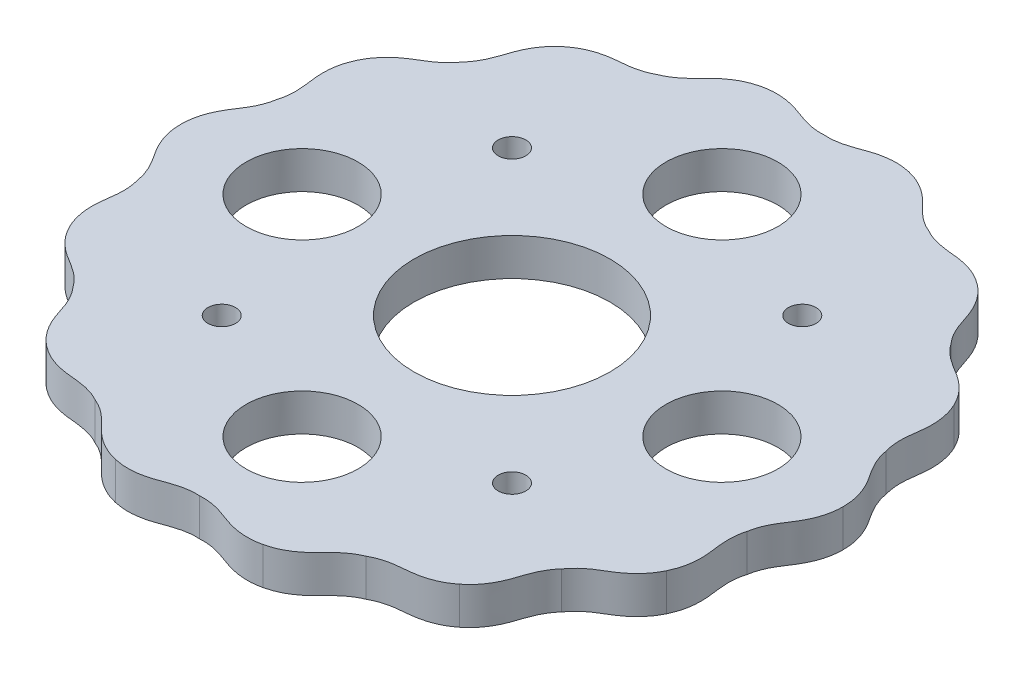
from build123d import *

# Parameters (mm, degrees)
BOSS_EXTRUDE3_DEPTH = 4
SKETCH2_R           = 10.5
SKETCH2_R_2         = 6
CUT_EXTRUDE1_DEPTH  = 5
SKETCH2_4_R         = 1.48
CUT_EXTRUDE2_DEPTH  = 2.22


with BuildPart() as part:
    # Sketch1 → Boss-Extrude3 (new body)
    with BuildSketch(Plane(origin=(0, 0, 0), x_dir=(1, 0, 0), z_dir=(0, 1, 0))):
        with BuildLine():
            Line((35.500002326, 0.003735881), (35.500002326, 0))
            Line((35.500002326, 0), (35.500002326, -0.003735881))
            add(Edge.make_bspline(
                [(32.644810899, -7.45096506), (32.674793712, -7.260710929), (32.757965618, -6.873262555), (32.975088878, -6.197475635), (33.30681421, -5.487322542), (33.693887271, -4.83935734), (34.139372051, -4.165162167), (34.499748971, -3.6014921), (34.870711868, -2.889611748), (35.149566879, -2.192738575), (35.418263863, -1.23361479), (35.50061524, -0.495919336), (35.500002326, -0.003735881)],
                knots=[0.02301065, 0.02301065, 0.02301065, 0.02301065, 0.053541567, 0.084072485, 0.145134319, 0.206196153, 0.267257988, 0.389381656, 0.511505325, 0.633628994, 0.755752663, 1, 1, 1, 1], degree=3))
            add(Edge.make_bspline(
                [(31.986017844, -15.399507835), (32.200120458, -14.956331799), (32.445998494, -14.255960238), (32.62005909, -13.275236314), (32.671181344, -12.526384626), (32.645828632, -11.724047822), (32.565707523, -11.059836954), (32.456861927, -10.25911949), (32.389262714, -9.507378309), (32.398512397, -8.723622254), (32.496104055, -8.020553026), (32.589276306, -7.635387164), (32.644810899, -7.45096506)],
                knots=[0.02301065, 0.02301065, 0.02301065, 0.02301065, 0.267257988, 0.389381656, 0.511505325, 0.633628994, 0.755752663, 0.816814497, 0.877876331, 0.938938166, 0.969469083, 1, 1, 1, 1], degree=3))
            Line((31.986017844, -15.399507835), (31.984396906, -15.402873748))
            Line((31.984396906, -15.402873748), (31.982775968, -15.406239661))
            add(Edge.make_bspline(
                [(26.179105738, -20.877140171), (26.288667493, -20.718736177), (26.531710341, -20.405744191), (27.020544594, -19.891087467), (27.62754267, -19.395191866), (28.257425012, -18.979340099), (28.951315253, -18.565199839), (29.520570914, -18.213712342), (30.163670245, -17.733285076), (30.717271866, -17.226414698), (31.375507699, -16.478857279), (31.769777787, -15.849947564), (31.982775968, -15.406239661)],
                knots=[0.02301065, 0.02301065, 0.02301065, 0.02301065, 0.053541567, 0.084072485, 0.145134319, 0.206196153, 0.267257988, 0.389381656, 0.511505325, 0.633628994, 0.755752663, 1, 1, 1, 1], degree=3))
            add(Edge.make_bspline(
                [(22.136810246, -27.752690162), (22.521996911, -27.446297993), (23.047405198, -26.921967502), (23.62974854, -26.113887841), (24.00072267, -25.461376898), (24.326001557, -24.727496287), (24.542005228, -24.094299727), (24.791357022, -23.325651886), (25.05662051, -22.619026286), (25.405013194, -21.916899767), (25.797990545, -21.325799714), (26.049053047, -21.019203188), (26.179105738, -20.877140171)],
                knots=[0.02301065, 0.02301065, 0.02301065, 0.02301065, 0.267257988, 0.389381656, 0.511505325, 0.633628994, 0.755752663, 0.816814497, 0.877876331, 0.938938166, 0.969469083, 1, 1, 1, 1], degree=3))
            Line((22.136810246, -27.752690162), (22.133889416, -27.755019446))
            Line((22.133889416, -27.755019446), (22.130968587, -27.75734873))
            add(Edge.make_bspline(
                [(14.52830762, -30.168341629), (14.695748267, -30.073161626), (15.05052444, -29.89661793), (15.714250068, -29.645025478), (16.476297475, -29.461605575), (17.224233175, -29.360231784), (18.029095404, -29.288171996), (18.694481743, -29.218483478), (19.482343797, -29.064663811), (20.201044438, -28.848188121), (21.118447439, -28.460259983), (21.746546212, -28.06469929), (22.130968587, -27.75734873)],
                knots=[0.02301065, 0.02301065, 0.02301065, 0.02301065, 0.053541567, 0.084072485, 0.145134319, 0.206196153, 0.267257988, 0.389381656, 0.511505325, 0.633628994, 0.755752663, 1, 1, 1, 1], degree=3))
            add(Edge.make_bspline(
                [(7.903135888, -34.609111839), (8.383115662, -34.500188263), (9.083990645, -34.255748926), (9.959276491, -33.780363616), (10.576626521, -33.353431213), (11.188111536, -32.833360849), (11.657457809, -32.356590942), (12.215619812, -31.772252855), (12.761207314, -31.250698702), (13.379739556, -30.769266488), (13.990268616, -30.407210225), (14.349495361, -30.239908237), (14.52830762, -30.168341629)],
                knots=[0.02301065, 0.02301065, 0.02301065, 0.02301065, 0.267257988, 0.389381656, 0.511505325, 0.633628994, 0.755752663, 0.816814497, 0.877876331, 0.938938166, 0.969469083, 1, 1, 1, 1], degree=3))
            Line((7.903135888, -34.609111839), (7.899493673, -34.60994315))
            Line((7.899493673, -34.60994315), (7.895851458, -34.610774462))
            add(Edge.make_bspline(
                [(0, -33.484333037), (0.192155866, -33.471228592), (0.588397592, -33.466099831), (1.295555593, -33.527402621), (2.061719496, -33.692786976), (2.779570716, -33.925969485), (3.535992098, -34.210262493), (4.165721189, -34.43617562), (4.942300224, -34.639429423), (5.683752409, -34.756224087), (6.678619663, -34.804759157), (7.416144457, -34.72089313), (7.895851458, -34.610774462)],
                knots=[0.02301065, 0.02301065, 0.02301065, 0.02301065, 0.053541567, 0.084072485, 0.145134319, 0.206196153, 0.267257988, 0.389381656, 0.511505325, 0.633628994, 0.755752663, 1, 1, 1, 1], degree=3))
            add(Edge.make_bspline(
                [(-7.895851458, -34.610774462), (-7.416144457, -34.72089313), (-6.678619663, -34.804759157), (-5.683752409, -34.756224087), (-4.942300224, -34.639429423), (-4.165721189, -34.43617562), (-3.535992098, -34.210262493), (-2.779570716, -33.925969485), (-2.061719496, -33.692786976), (-1.295555593, -33.527402621), (-0.588397592, -33.466099831), (-0.192155866, -33.471228592), (0, -33.484333037)],
                knots=[0.02301065, 0.02301065, 0.02301065, 0.02301065, 0.267257988, 0.389381656, 0.511505325, 0.633628994, 0.755752663, 0.816814497, 0.877876331, 0.938938166, 0.969469083, 1, 1, 1, 1], degree=3))
            Line((-7.895851458, -34.610774462), (-7.899493673, -34.60994315))
            Line((-7.899493673, -34.60994315), (-7.903135888, -34.609111839))
            add(Edge.make_bspline(
                [(-14.52830762, -30.168341629), (-14.349495361, -30.239908237), (-13.990268616, -30.407210225), (-13.379739556, -30.769266488), (-12.761207314, -31.250698702), (-12.215619812, -31.772252855), (-11.657457809, -32.356590942), (-11.188111536, -32.833360849), (-10.576626521, -33.353431213), (-9.959276491, -33.780363616), (-9.083990645, -34.255748926), (-8.383115662, -34.500188263), (-7.903135888, -34.609111839)],
                knots=[0.02301065, 0.02301065, 0.02301065, 0.02301065, 0.053541567, 0.084072485, 0.145134319, 0.206196153, 0.267257988, 0.389381656, 0.511505325, 0.633628994, 0.755752663, 1, 1, 1, 1], degree=3))
            add(Edge.make_bspline(
                [(-22.130968587, -27.75734873), (-21.746546212, -28.06469929), (-21.118447439, -28.460259983), (-20.201044438, -28.848188121), (-19.482343797, -29.064663811), (-18.694481743, -29.218483478), (-18.029095404, -29.288171996), (-17.224233175, -29.360231784), (-16.476297475, -29.461605575), (-15.714250068, -29.645025478), (-15.05052444, -29.89661793), (-14.695748267, -30.073161626), (-14.52830762, -30.168341629)],
                knots=[0.02301065, 0.02301065, 0.02301065, 0.02301065, 0.267257988, 0.389381656, 0.511505325, 0.633628994, 0.755752663, 0.816814497, 0.877876331, 0.938938166, 0.969469083, 1, 1, 1, 1], degree=3))
            Line((-22.130968587, -27.75734873), (-22.133889416, -27.755019446))
            Line((-22.133889416, -27.755019446), (-22.136810246, -27.752690162))
            add(Edge.make_bspline(
                [(-26.179105738, -20.877140171), (-26.049053047, -21.019203188), (-25.797990545, -21.325799714), (-25.405013194, -21.916899767), (-25.05662051, -22.619026286), (-24.791357022, -23.325651886), (-24.542005228, -24.094299727), (-24.326001557, -24.727496287), (-24.00072267, -25.461376898), (-23.62974854, -26.113887841), (-23.047405198, -26.921967502), (-22.521996911, -27.446297993), (-22.136810246, -27.752690162)],
                knots=[0.02301065, 0.02301065, 0.02301065, 0.02301065, 0.053541567, 0.084072485, 0.145134319, 0.206196153, 0.267257988, 0.389381656, 0.511505325, 0.633628994, 0.755752663, 1, 1, 1, 1], degree=3))
            add(Edge.make_bspline(
                [(-31.982775968, -15.406239661), (-31.769777787, -15.849947564), (-31.375507698, -16.478857279), (-30.717271866, -17.226414698), (-30.163670245, -17.733285076), (-29.520570914, -18.213712342), (-28.951315253, -18.565199839), (-28.257425012, -18.979340099), (-27.62754267, -19.395191866), (-27.020544594, -19.891087467), (-26.531710341, -20.405744191), (-26.288667493, -20.718736177), (-26.179105738, -20.877140171)],
                knots=[0.02301065, 0.02301065, 0.02301065, 0.02301065, 0.267257988, 0.389381656, 0.511505325, 0.633628994, 0.755752663, 0.816814497, 0.877876331, 0.938938166, 0.969469083, 1, 1, 1, 1], degree=3))
            Line((-31.982775968, -15.406239661), (-31.984396906, -15.402873748))
            Line((-31.984396906, -15.402873748), (-31.986017844, -15.399507835))
            add(Edge.make_bspline(
                [(-32.644810899, -7.45096506), (-32.589276306, -7.635387164), (-32.496104055, -8.020553026), (-32.398512397, -8.723622254), (-32.389262714, -9.507378309), (-32.456861927, -10.25911949), (-32.565707523, -11.059836954), (-32.645828632, -11.724047822), (-32.671181344, -12.526384626), (-32.62005909, -13.275236314), (-32.445998494, -14.255960238), (-32.200120458, -14.956331799), (-31.986017844, -15.399507835)],
                knots=[0.02301065, 0.02301065, 0.02301065, 0.02301065, 0.053541567, 0.084072485, 0.145134319, 0.206196153, 0.267257988, 0.389381656, 0.511505325, 0.633628994, 0.755752663, 1, 1, 1, 1], degree=3))
            add(Edge.make_bspline(
                [(-35.500002326, -0.003735881), (-35.50061524, -0.495919336), (-35.418263863, -1.23361479), (-35.149566879, -2.192738575), (-34.870711868, -2.889611748), (-34.499748971, -3.6014921), (-34.139372051, -4.165162167), (-33.693887271, -4.83935734), (-33.30681421, -5.487322542), (-32.975088878, -6.197475635), (-32.757965618, -6.873262555), (-32.674793712, -7.260710929), (-32.644810899, -7.45096506)],
                knots=[0.02301065, 0.02301065, 0.02301065, 0.02301065, 0.267257988, 0.389381656, 0.511505325, 0.633628994, 0.755752663, 0.816814497, 0.877876331, 0.938938166, 0.969469083, 1, 1, 1, 1], degree=3))
            Line((-35.500002326, -0.003735881), (-35.500002326, 0))
            Line((-35.500002326, 0), (-35.500002326, 0.003735881))
            add(Edge.make_bspline(
                [(-32.644810899, 7.45096506), (-32.674793712, 7.260710929), (-32.757965618, 6.873262555), (-32.975088878, 6.197475635), (-33.30681421, 5.487322542), (-33.693887271, 4.83935734), (-34.139372051, 4.165162167), (-34.499748971, 3.6014921), (-34.870711868, 2.889611748), (-35.149566879, 2.192738575), (-35.418263863, 1.23361479), (-35.50061524, 0.495919336), (-35.500002326, 0.003735881)],
                knots=[0.02301065, 0.02301065, 0.02301065, 0.02301065, 0.053541567, 0.084072485, 0.145134319, 0.206196153, 0.267257988, 0.389381656, 0.511505325, 0.633628994, 0.755752663, 1, 1, 1, 1], degree=3))
            add(Edge.make_bspline(
                [(-31.986017844, 15.399507835), (-32.200120458, 14.956331799), (-32.445998494, 14.255960238), (-32.62005909, 13.275236314), (-32.671181344, 12.526384626), (-32.645828632, 11.724047822), (-32.565707523, 11.059836954), (-32.456861927, 10.25911949), (-32.389262714, 9.507378309), (-32.398512397, 8.723622254), (-32.496104055, 8.020553026), (-32.589276306, 7.635387164), (-32.644810899, 7.45096506)],
                knots=[0.02301065, 0.02301065, 0.02301065, 0.02301065, 0.267257988, 0.389381656, 0.511505325, 0.633628994, 0.755752663, 0.816814497, 0.877876331, 0.938938166, 0.969469083, 1, 1, 1, 1], degree=3))
            Line((-31.986017844, 15.399507835), (-31.984396906, 15.402873748))
            Line((-31.984396906, 15.402873748), (-31.982775968, 15.406239661))
            add(Edge.make_bspline(
                [(-26.179105738, 20.877140171), (-26.288667493, 20.718736177), (-26.531710341, 20.405744191), (-27.020544594, 19.891087467), (-27.62754267, 19.395191866), (-28.257425012, 18.979340099), (-28.951315253, 18.565199839), (-29.520570914, 18.213712342), (-30.163670245, 17.733285076), (-30.717271866, 17.226414698), (-31.375507699, 16.478857278), (-31.769777787, 15.849947564), (-31.982775968, 15.406239661)],
                knots=[0.02301065, 0.02301065, 0.02301065, 0.02301065, 0.053541567, 0.084072485, 0.145134319, 0.206196153, 0.267257988, 0.389381656, 0.511505325, 0.633628994, 0.755752663, 1, 1, 1, 1], degree=3))
            add(Edge.make_bspline(
                [(-22.136810246, 27.752690162), (-22.521996911, 27.446297993), (-23.047405198, 26.921967502), (-23.62974854, 26.113887841), (-24.00072267, 25.461376898), (-24.326001557, 24.727496287), (-24.542005228, 24.094299727), (-24.791357022, 23.325651886), (-25.05662051, 22.619026286), (-25.405013194, 21.916899767), (-25.797990545, 21.325799714), (-26.049053047, 21.019203188), (-26.179105738, 20.877140171)],
                knots=[0.02301065, 0.02301065, 0.02301065, 0.02301065, 0.267257988, 0.389381656, 0.511505325, 0.633628994, 0.755752663, 0.816814497, 0.877876331, 0.938938166, 0.969469083, 1, 1, 1, 1], degree=3))
            Line((-22.136810246, 27.752690162), (-22.133889416, 27.755019446))
            Line((-22.133889416, 27.755019446), (-22.130968587, 27.75734873))
            add(Edge.make_bspline(
                [(-14.52830762, 30.168341629), (-14.695748267, 30.073161626), (-15.05052444, 29.89661793), (-15.714250068, 29.645025478), (-16.476297475, 29.461605575), (-17.224233175, 29.360231784), (-18.029095404, 29.288171996), (-18.694481743, 29.218483478), (-19.482343797, 29.064663811), (-20.201044438, 28.848188121), (-21.118447439, 28.460259983), (-21.746546212, 28.06469929), (-22.130968587, 27.75734873)],
                knots=[0.02301065, 0.02301065, 0.02301065, 0.02301065, 0.053541567, 0.084072485, 0.145134319, 0.206196153, 0.267257988, 0.389381656, 0.511505325, 0.633628994, 0.755752663, 1, 1, 1, 1], degree=3))
            add(Edge.make_bspline(
                [(-7.903135888, 34.609111839), (-8.383115662, 34.500188263), (-9.083990645, 34.255748926), (-9.959276491, 33.780363616), (-10.576626521, 33.353431213), (-11.188111536, 32.833360849), (-11.657457809, 32.356590942), (-12.215619812, 31.772252855), (-12.761207314, 31.250698702), (-13.379739556, 30.769266488), (-13.990268616, 30.407210225), (-14.349495361, 30.239908237), (-14.52830762, 30.168341629)],
                knots=[0.02301065, 0.02301065, 0.02301065, 0.02301065, 0.267257988, 0.389381656, 0.511505325, 0.633628994, 0.755752663, 0.816814497, 0.877876331, 0.938938166, 0.969469083, 1, 1, 1, 1], degree=3))
            Line((-7.903135888, 34.609111839), (-7.899493673, 34.60994315))
            Line((-7.899493673, 34.60994315), (-7.895851458, 34.610774462))
            add(Edge.make_bspline(
                [(0, 33.484333037), (-0.192155866, 33.471228592), (-0.588397592, 33.466099831), (-1.295555593, 33.527402621), (-2.061719496, 33.692786976), (-2.779570716, 33.925969485), (-3.535992098, 34.210262493), (-4.165721189, 34.43617562), (-4.942300224, 34.639429423), (-5.683752409, 34.756224087), (-6.678619663, 34.804759157), (-7.416144457, 34.72089313), (-7.895851458, 34.610774462)],
                knots=[0.02301065, 0.02301065, 0.02301065, 0.02301065, 0.053541567, 0.084072485, 0.145134319, 0.206196153, 0.267257988, 0.389381656, 0.511505325, 0.633628994, 0.755752663, 1, 1, 1, 1], degree=3))
            add(Edge.make_bspline(
                [(7.895851458, 34.610774462), (7.416144457, 34.72089313), (6.678619663, 34.804759157), (5.683752409, 34.756224087), (4.942300224, 34.639429423), (4.165721189, 34.43617562), (3.535992098, 34.210262493), (2.779570716, 33.925969485), (2.061719496, 33.692786976), (1.295555593, 33.527402621), (0.588397592, 33.466099831), (0.192155866, 33.471228592), (0, 33.484333037)],
                knots=[0.02301065, 0.02301065, 0.02301065, 0.02301065, 0.267257988, 0.389381656, 0.511505325, 0.633628994, 0.755752663, 0.816814497, 0.877876331, 0.938938166, 0.969469083, 1, 1, 1, 1], degree=3))
            Line((7.895851458, 34.610774462), (7.899493673, 34.60994315))
            Line((7.899493673, 34.60994315), (7.903135888, 34.609111839))
            add(Edge.make_bspline(
                [(14.52830762, 30.168341629), (14.349495361, 30.239908237), (13.990268616, 30.407210225), (13.379739556, 30.769266488), (12.761207314, 31.250698702), (12.215619812, 31.772252855), (11.657457809, 32.356590942), (11.188111536, 32.833360849), (10.576626521, 33.353431213), (9.959276491, 33.780363616), (9.083990645, 34.255748926), (8.383115662, 34.500188263), (7.903135888, 34.609111839)],
                knots=[0.02301065, 0.02301065, 0.02301065, 0.02301065, 0.053541567, 0.084072485, 0.145134319, 0.206196153, 0.267257988, 0.389381656, 0.511505325, 0.633628994, 0.755752663, 1, 1, 1, 1], degree=3))
            add(Edge.make_bspline(
                [(22.130968587, 27.75734873), (21.746546212, 28.06469929), (21.118447439, 28.460259983), (20.201044438, 28.848188121), (19.482343797, 29.064663811), (18.694481743, 29.218483478), (18.029095404, 29.288171996), (17.224233175, 29.360231784), (16.476297475, 29.461605575), (15.714250068, 29.645025478), (15.05052444, 29.89661793), (14.695748267, 30.073161626), (14.52830762, 30.168341629)],
                knots=[0.02301065, 0.02301065, 0.02301065, 0.02301065, 0.267257988, 0.389381656, 0.511505325, 0.633628994, 0.755752663, 0.816814497, 0.877876331, 0.938938166, 0.969469083, 1, 1, 1, 1], degree=3))
            Line((22.130968587, 27.75734873), (22.133889416, 27.755019446))
            Line((22.133889416, 27.755019446), (22.136810246, 27.752690162))
            add(Edge.make_bspline(
                [(26.179105738, 20.877140171), (26.049053047, 21.019203188), (25.797990545, 21.325799714), (25.405013194, 21.916899767), (25.05662051, 22.619026286), (24.791357022, 23.325651886), (24.542005228, 24.094299727), (24.326001557, 24.727496287), (24.00072267, 25.461376898), (23.62974854, 26.113887841), (23.047405198, 26.921967502), (22.521996911, 27.446297993), (22.136810246, 27.752690162)],
                knots=[0.02301065, 0.02301065, 0.02301065, 0.02301065, 0.053541567, 0.084072485, 0.145134319, 0.206196153, 0.267257988, 0.389381656, 0.511505325, 0.633628994, 0.755752663, 1, 1, 1, 1], degree=3))
            add(Edge.make_bspline(
                [(31.982775968, 15.406239661), (31.769777787, 15.849947564), (31.375507698, 16.478857279), (30.717271866, 17.226414698), (30.163670245, 17.733285076), (29.520570914, 18.213712342), (28.951315253, 18.565199839), (28.257425012, 18.979340099), (27.62754267, 19.395191866), (27.020544594, 19.891087467), (26.531710341, 20.405744191), (26.288667493, 20.718736177), (26.179105738, 20.877140171)],
                knots=[0.02301065, 0.02301065, 0.02301065, 0.02301065, 0.267257988, 0.389381656, 0.511505325, 0.633628994, 0.755752663, 0.816814497, 0.877876331, 0.938938166, 0.969469083, 1, 1, 1, 1], degree=3))
            Line((31.982775968, 15.406239661), (31.984396906, 15.402873748))
            Line((31.984396906, 15.402873748), (31.986017844, 15.399507835))
            add(Edge.make_bspline(
                [(32.644810899, 7.45096506), (32.589276306, 7.635387164), (32.496104055, 8.020553026), (32.398512397, 8.723622254), (32.389262714, 9.507378309), (32.456861927, 10.25911949), (32.565707523, 11.059836954), (32.645828632, 11.724047822), (32.671181344, 12.526384626), (32.62005909, 13.275236314), (32.445998494, 14.255960238), (32.200120458, 14.956331799), (31.986017844, 15.399507835)],
                knots=[0.02301065, 0.02301065, 0.02301065, 0.02301065, 0.053541567, 0.084072485, 0.145134319, 0.206196153, 0.267257988, 0.389381656, 0.511505325, 0.633628994, 0.755752663, 1, 1, 1, 1], degree=3))
            add(Edge.make_bspline(
                [(35.500002326, 0.003735881), (35.50061524, 0.495919336), (35.418263863, 1.23361479), (35.149566879, 2.192738575), (34.870711868, 2.889611748), (34.499748971, 3.6014921), (34.139372051, 4.165162167), (33.693887271, 4.83935734), (33.30681421, 5.487322542), (32.975088878, 6.197475635), (32.757965618, 6.873262555), (32.674793712, 7.260710929), (32.644810899, 7.45096506)],
                knots=[0.02301065, 0.02301065, 0.02301065, 0.02301065, 0.267257988, 0.389381656, 0.511505325, 0.633628994, 0.755752663, 0.816814497, 0.877876331, 0.938938166, 0.969469083, 1, 1, 1, 1], degree=3))
        make_face()
    extrude(amount=BOSS_EXTRUDE3_DEPTH)

    # Sketch2 → Cut-Extrude1 (cut)
    with BuildSketch(Plane(origin=(0, 4, 0), x_dir=(1, 0, 0), z_dir=(0, 1, 0))):
        Circle(SKETCH2_R)
        with Locations((22.5, 0)):
            Circle(SKETCH2_R_2)
        with Locations((0, -22.5)):
            Circle(SKETCH2_R_2)
        with Locations((-22.5, 0)):
            Circle(SKETCH2_R_2)
        with Locations((0, 22.5)):
            Circle(SKETCH2_R_2)
    extrude(amount=-CUT_EXTRUDE1_DEPTH, mode=Mode.SUBTRACT)

    # Sketch2<4> → Cut-Extrude2 (cut)
    with BuildSketch(Plane(origin=(0, 4, 0), x_dir=(1, 0, 0), z_dir=(0, 1, 0))):
        with Locations((15.556349186, 15.556349186)):
            Circle(SKETCH2_4_R)
        with Locations((15.556349186, -15.556349186)):
            Circle(SKETCH2_4_R)
        with Locations((-15.556349186, -15.556349186)):
            Circle(SKETCH2_4_R)
        with Locations((-15.556349186, 15.556349186)):
            Circle(SKETCH2_4_R)
    extrude(amount=-CUT_EXTRUDE2_DEPTH, mode=Mode.SUBTRACT)


solid = part.part
